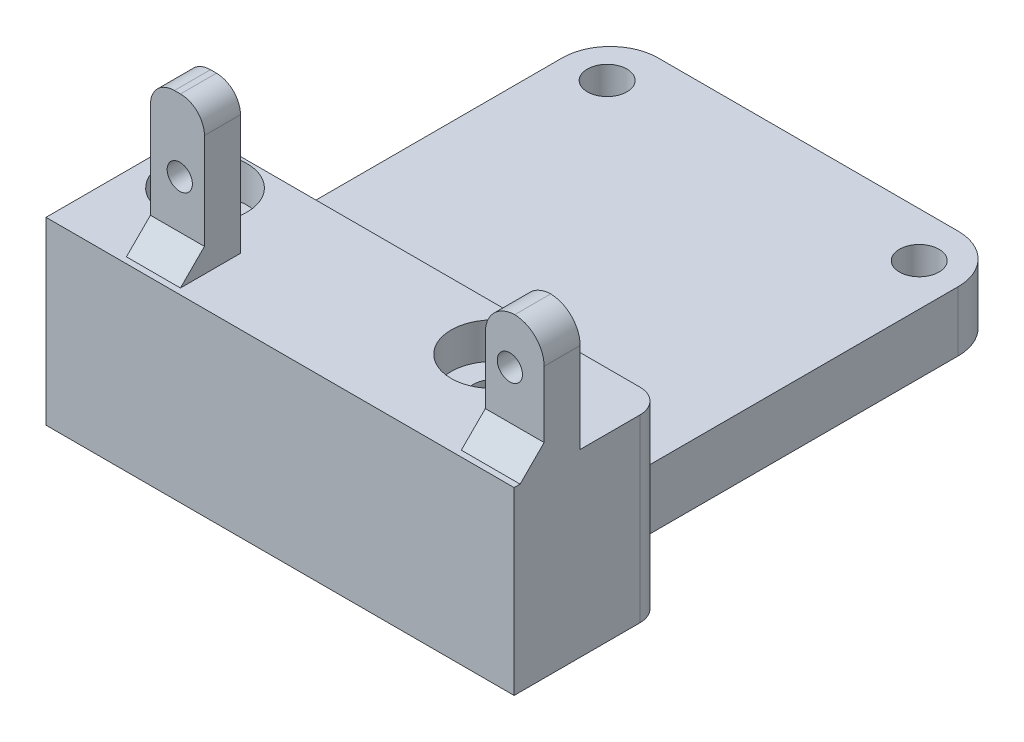
from build123d import *

# Parameters (mm, degrees)
SKETCH1_W           = 33
SKETCH1_H           = 42
BOSS_EXTRUDE1_DEPTH = 5
SKETCH4_R           = 1.65
CUT_EXTRUDE1_DEPTH  = 10
SKETCH6_W           = 6
SKETCH6_H           = 7.490694283
BOSS_EXTRUDE2_DEPTH = 5
BOSS_EXTRUDE4_START = 10
SKETCH8_R           = 1.65
BOSS_EXTRUDE4_DEPTH = 10
SKETCH9_W           = 4.9
SKETCH9_H           = 3
BOSS_EXTRUDE5_DEPTH = 10
FILLET2_R           = 2.5
CUT_EXTRUDE3_DEPTH  = 10
SKETCH11_W          = 33
SKETCH11_H          = 34.509305717
CUT_EXTRUDE4_DEPTH  = 10
FILLET3_R           = 4
FILLET4_R           = 2
FILLET5_R           = 4
SKETCH12_R          = 3.5
CUT_EXTRUDE5_DEPTH  = 3
SKETCH13_W          = 4.5
SKETCH13_H          = 3
BOSS_EXTRUDE6_DEPTH = 12
FILLET6_R           = 2
CUT_EXTRUDE6_DEPTH  = 7
CHAMFER1_SIZE       = 2


# Some blends are built 0.0001 mm under size
with BuildPart() as part:
    # Sketch1 → Boss-Extrude1 (new body)
    with BuildSketch(Plane(origin=(0, 0, 0), x_dir=(1, 0, 0), z_dir=(0, 1, 0))):
        with Locations((16.5, 21)):
            Rectangle(SKETCH1_W, SKETCH1_H)
    extrude(amount=BOSS_EXTRUDE1_DEPTH)

    # Sketch4 → Cut-Extrude1 (cut)
    with BuildSketch(Plane(origin=(0, 5, 0), x_dir=(1, 0, 0), z_dir=(0, 1, 0))):
        with Locations(Location((4.500000179, 3.75, 0), (0, 0, 270))):
            Circle(SKETCH4_R)
        with Locations(Location((3.500000179, 38.249999434, 0), (0, 0, 270))):
            Circle(SKETCH4_R)
        with Locations(Location((29.5, 38.249999434, 0), (0, 0, 270))):
            Circle(SKETCH4_R)
        with Locations(Location((28.5, 3.75, 0), (0, 0, 270))):
            Circle(SKETCH4_R)
    extrude(amount=-CUT_EXTRUDE1_DEPTH, mode=Mode.SUBTRACT)

    # Sketch6 → Boss-Extrude2 (add)
    with BuildSketch(Plane(origin=(0, 5, 0), x_dir=(1, 0, 0), z_dir=(0, 1, 0))):
        with Locations((36, 3.745347142)):
            Rectangle(SKETCH6_W, SKETCH6_H)
        Polygon((0, -5), (0, 0), (33, 0), (39, 0), (39, -5), align=None)
    extrude(amount=-BOSS_EXTRUDE2_DEPTH)

    # Sketch8 → Boss-Extrude4 (add)
    with BuildSketch(Plane(origin=(0, 5, 0), x_dir=(1, 0, 0), z_dir=(0, 1, 0)).offset(BOSS_EXTRUDE4_START)):
        Polygon((39, 7.490694283), (33, 7.490694283), (33, 42), (0, 42), (0, -5), (39, -5), align=None)
        with Locations(Location((29.5, 38.249999434, 0), (0, 0, 270))):
            Circle(SKETCH8_R, mode=Mode.SUBTRACT)
        with Locations(Location((3.500000179, 38.249999434, 0), (0, 0, 270))):
            Circle(SKETCH8_R, mode=Mode.SUBTRACT)
        with Locations(Location((4.500000179, 3.75, 0), (0, 0, 270))):
            Circle(SKETCH8_R, mode=Mode.SUBTRACT)
        with Locations(Location((28.5, 3.75, 0), (0, 0, 270))):
            Circle(SKETCH8_R, mode=Mode.SUBTRACT)
    extrude(amount=-BOSS_EXTRUDE4_DEPTH)

    # Sketch9 → Boss-Extrude5 (add)
    with BuildSketch(Plane(origin=(0, 15, 0), x_dir=(1, 0, 0), z_dir=(0, 1, 0))):
        with Locations((36.55, -1)):
            Rectangle(SKETCH9_W, SKETCH9_H)
    extrude(amount=BOSS_EXTRUDE5_DEPTH)

    # Fillet2
    # the kernel refuses this fillet: 2.5 mm, written as the material it takes off along each edge
    with BuildSketch(Plane(origin=(34.1, 25, -6.75), x_dir=(0, -1, 0), z_dir=(0, 0, 1)), Plane(origin=(39, 25, 8.75), x_dir=(0, -1, 0), z_dir=(0, 0, -1))) as fillet2_piece_1:
        with BuildLine():
            CenterArc((FILLET2_R, FILLET2_R), FILLET2_R, 180, 90)
            Line((0, FILLET2_R), (0, 0))
            Line((0, 0), (FILLET2_R, 0))
        make_face()
    extrude(amount=15.5, mode=Mode.SUBTRACT)

    # Sketch10 → Cut-Extrude3 (cut)
    with BuildSketch(Plane(origin=(0, 0, -0.5), x_dir=(-1, 0, 0), z_dir=(0, 0, -1))):
        with BuildLine():
            ThreePointArc((-37.068227721, 21.5), (-37.194918455, 21), (-37.068227721, 20.5))
            ThreePointArc((-37.068227721, 20.5), (-35.887018018, 19.982165355), (-35.094918455, 21))
            ThreePointArc((-35.094918455, 21), (-35.887018018, 22.017834645), (-37.068227721, 21.5))
        make_face()
    extrude(amount=-CUT_EXTRUDE3_DEPTH, mode=Mode.SUBTRACT)

    # Sketch11 → Cut-Extrude4 (cut)
    with BuildSketch(Plane(origin=(0, 15, 0), x_dir=(1, 0, 0), z_dir=(0, 1, 0))):
        with Locations((16.5, 24.745347142)):
            Rectangle(SKETCH11_W, SKETCH11_H)
    extrude(amount=-CUT_EXTRUDE4_DEPTH, mode=Mode.SUBTRACT)

    # Fillet3
    fillet3_edges = [part.edges().sort_by_distance(p)[0] for p in [
        (0, 2.5, -42),
        (33, 2.5, -42),
        (33, 2.5, -7.490694283),
    ]]
    fillet(fillet3_edges, radius=FILLET3_R)

    # Fillet4
    fillet4_edges = [part.edges().sort_by_distance(p)[0] for p in [
        (39, 7.5, -7.490694283),
    ]]
    fillet(fillet4_edges, radius=FILLET4_R - 0.0001)  # a hair under: the kernel refuses the full size

    # Fillet5
    fillet5_edges = [part.edges().sort_by_distance(p)[0] for p in [
        (18.5, 5, -7.490694283),
    ]]
    fillet(fillet5_edges, radius=FILLET5_R)

    # Sketch12 → Cut-Extrude5 (cut)
    with BuildSketch(Plane(origin=(0, 15, 0), x_dir=(1, 0, 0), z_dir=(0, 1, 0))):
        with Locations(Location((4.500000179, 3.75, 0), (0, 0, 270))):
            Circle(SKETCH12_R)
        with Locations(Location((28.5, 3.75, 0), (0, 0, 270))):
            Circle(SKETCH12_R)
    extrude(amount=-CUT_EXTRUDE5_DEPTH, mode=Mode.SUBTRACT)

    # Sketch13 → Boss-Extrude6 (add)
    with BuildSketch(Plane(origin=(0, 15, 0), x_dir=(1, 0, 0), z_dir=(0, 1, 0))):
        with Locations((8.45, -1)):
            Rectangle(SKETCH13_W, SKETCH13_H)
    extrude(amount=BOSS_EXTRUDE6_DEPTH)

    # Fillet6
    fillet6_edges = [part.edges().sort_by_distance(p)[0] for p in [
        (6.2, 27, 1),
        (10.7, 27, 1),
    ]]
    fillet(fillet6_edges, radius=FILLET6_R)

    # Sketch14 → Cut-Extrude6 (cut)
    with BuildSketch(Plane(origin=(0, 0, -0.5), x_dir=(-1, 0, 0), z_dir=(0, 0, -1))):
        with BuildLine():
            ThreePointArc((-7.594918455, 21), (-7.62708381, 21.257900437), (-7.721609189, 21.5))
            ThreePointArc((-7.721609189, 21.5), (-9.694918455, 21), (-7.721609189, 20.5))
            ThreePointArc((-7.721609189, 20.5), (-7.62708381, 20.742099563), (-7.594918455, 21))
        make_face()
    extrude(amount=-CUT_EXTRUDE6_DEPTH, mode=Mode.SUBTRACT)

    # Chamfer1
    chamfer1_edges = [part.edges().sort_by_distance(p)[0] for p in [
        (8.45, 15, 2.5),
        (36.55, 15, 2.5),
    ]]
    chamfer(chamfer1_edges, length=CHAMFER1_SIZE)


solid = part.part
